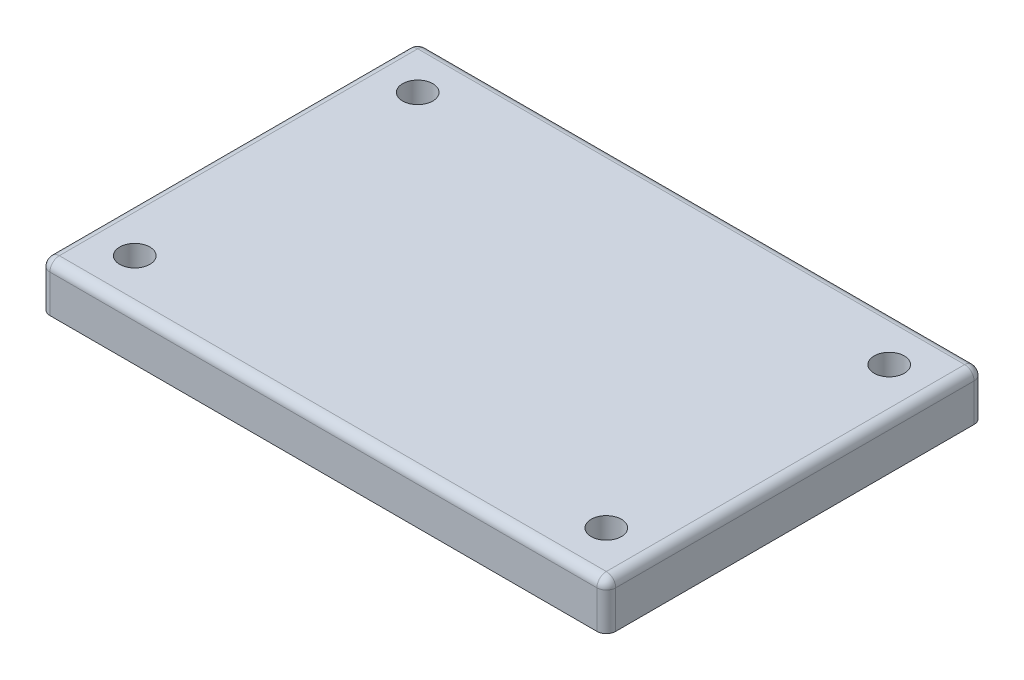
from build123d import *

# Parameters (mm, degrees)
SKETCH1_W           = 60
SKETCH1_H           = 40
BOSS_EXTRUDE1_DEPTH = 5
SKETCH2_R           = 1.6
CUT_EXTRUDE1_DEPTH  = 5
FILLET1_R           = 1
FILLET2_R           = 1


with BuildPart() as part:
    # Sketch1 → Boss-Extrude1 (new body)
    with BuildSketch(Plane(origin=(0, 0, 0), x_dir=(1, 0, 0), z_dir=(0, 1, 0))):
        Rectangle(SKETCH1_W, SKETCH1_H)
    extrude(amount=BOSS_EXTRUDE1_DEPTH)

    # Sketch2 → Cut-Extrude1 (cut)
    with BuildSketch(Plane(origin=(0, 5, 0), x_dir=(1, 0, 0), z_dir=(0, 1, 0))):
        with Locations(Location((-25, 15, 0), (0, 0, 270))):
            Circle(SKETCH2_R)
        with Locations(Location((25, -15, 0), (0, 0, 270))):
            Circle(SKETCH2_R)
        with Locations(Location((-25, -15, 0), (0, 0, 270))):
            Circle(SKETCH2_R)
        with Locations(Location((25, 15, 0), (0, 0, 270))):
            Circle(SKETCH2_R)
    extrude(amount=-CUT_EXTRUDE1_DEPTH, mode=Mode.SUBTRACT)

    # Fillet1
    fillet1_edges = [part.edges().sort_by_distance(p)[0] for p in [
        (-30, 5, 0),
        (0, 5, 20),
        (30, 5, 0),
        (0, 5, -20),
    ]]
    fillet(fillet1_edges, radius=FILLET1_R)

    # Fillet2
    # the kernel refuses this fillet: 1 mm, written as the material it takes off along each edge
    with BuildSketch(Plane(origin=(29, 4, -19), x_dir=(1, 0, 0), z_dir=(0, 0, -1))) as fillet2_piece_1_section:
        Polygon((0, 0), (FILLET2_R, 0), (FILLET2_R, -FILLET2_R), (0, -FILLET2_R), align=None)
    fillet2_piece_1 = extrude(amount=FILLET2_R, mode=Mode.PRIVATE)
    fillet2_piece_1 = fillet2_piece_1 - Plane(origin=(29, 4, -19), x_dir=(-0.7071067811865475, -0.7071067811865475, 0), z_dir=(0, 0, -1)) * Sphere(FILLET2_R, mode=Mode.PRIVATE)
    add(fillet2_piece_1, mode=Mode.SUBTRACT)
    with BuildSketch(Plane(origin=(29, 4, 19), x_dir=(0, 0, 1), z_dir=(1, 0, 0))) as fillet2_piece_2_section:
        Polygon((0, 0), (FILLET2_R, 0), (FILLET2_R, -FILLET2_R), (0, -FILLET2_R), align=None)
    fillet2_piece_2 = extrude(amount=FILLET2_R, mode=Mode.PRIVATE)
    fillet2_piece_2 = fillet2_piece_2 - Plane(origin=(29, 4, 19), x_dir=(0, -0.7071067811865475, -0.7071067811865475), z_dir=(1, 0, 0)) * Sphere(FILLET2_R, mode=Mode.PRIVATE)
    add(fillet2_piece_2, mode=Mode.SUBTRACT)
    with BuildSketch(Plane(origin=(-29, 4, -19), x_dir=(-1, 0, 0), z_dir=(0, 0, -1))) as fillet2_piece_3_section:
        Polygon((0, 0), (FILLET2_R, 0), (FILLET2_R, FILLET2_R), (0, FILLET2_R), align=None)
    fillet2_piece_3 = extrude(amount=FILLET2_R, mode=Mode.PRIVATE)
    fillet2_piece_3 = fillet2_piece_3 - Plane(origin=(-29, 4, -19), x_dir=(0.7071067811865475, -0.7071067811865475, 0), z_dir=(0, 0, -1)) * Sphere(FILLET2_R, mode=Mode.PRIVATE)
    add(fillet2_piece_3, mode=Mode.SUBTRACT)
    with BuildSketch(Plane(origin=(-29, 4, 19), x_dir=(0, 0, 1), z_dir=(-1, 0, 0))) as fillet2_piece_4_section:
        Polygon((0, 0), (FILLET2_R, 0), (FILLET2_R, FILLET2_R), (0, FILLET2_R), align=None)
    fillet2_piece_4 = extrude(amount=FILLET2_R, mode=Mode.PRIVATE)
    fillet2_piece_4 = fillet2_piece_4 - Plane(origin=(-29, 4, 19), x_dir=(0, -0.7071067811865475, -0.7071067811865475), z_dir=(-1, 0, 0)) * Sphere(FILLET2_R, mode=Mode.PRIVATE)
    add(fillet2_piece_4, mode=Mode.SUBTRACT)
    with BuildSketch(Plane(origin=(-30, -2.5, 20), x_dir=(0, 0, -1), z_dir=(0, 1, 0)), Plane(origin=(-30, -2.5, -20), x_dir=(1, 0, 0), z_dir=(0, 1, 0))) as fillet2_piece_5:
        with BuildLine():
            CenterArc((FILLET2_R, -FILLET2_R), FILLET2_R, 90, 90)
            Line((0, -FILLET2_R), (0, 0))
            Line((0, 0), (FILLET2_R, 0))
        make_face()
    extrude(amount=6.5, mode=Mode.SUBTRACT)
    with BuildSketch(Plane(origin=(30, -2.5, -20), x_dir=(-1, 0, 0), z_dir=(0, 1, 0)), Plane(origin=(30, -2.5, 20), x_dir=(0, 0, -1), z_dir=(0, 1, 0))) as fillet2_piece_6:
        with BuildLine():
            CenterArc((FILLET2_R, FILLET2_R), FILLET2_R, 180, 90)
            Line((0, FILLET2_R), (0, 0))
            Line((0, 0), (FILLET2_R, 0))
        make_face()
    extrude(amount=6.5, mode=Mode.SUBTRACT)


solid = part.part
